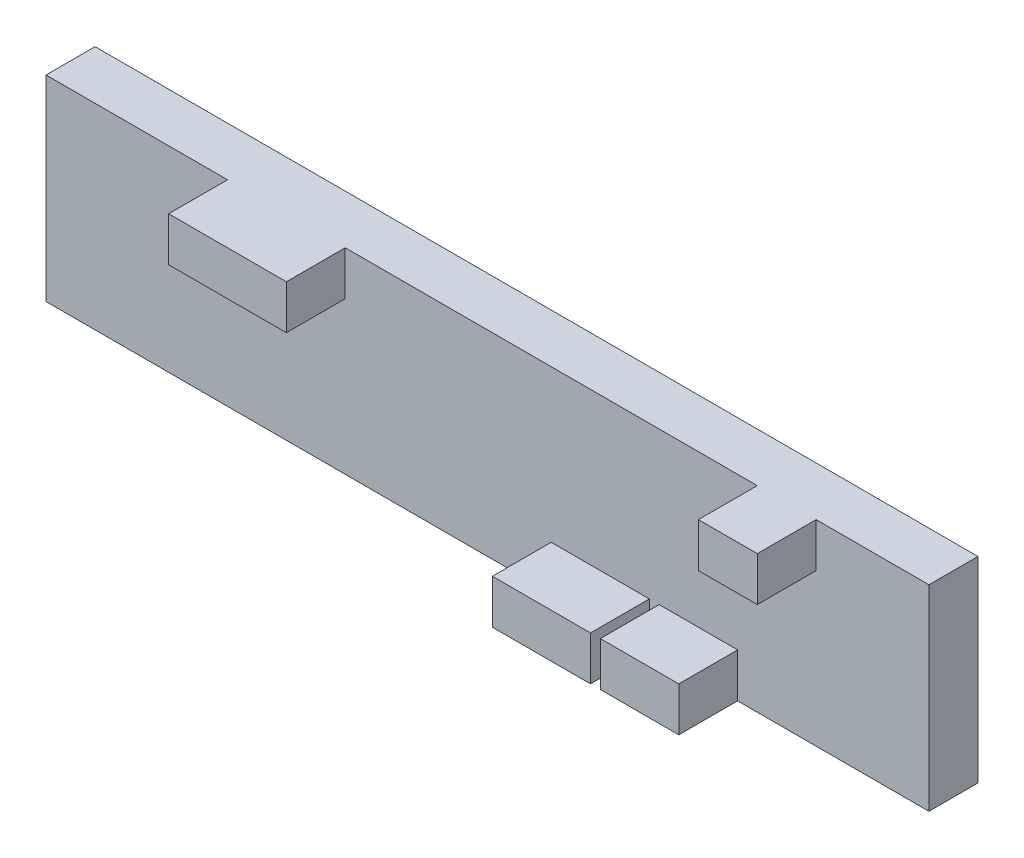
from build123d import *

# Parameters (mm, degrees)
SKETCH_1_W          = 91
SKETCH_1_H          = 20
EXTRUDE_1_DEPTH     = 5
SKETCH_2_W          = 12
SKETCH_2_H          = 4.5
SKETCH_2_W_2        = 6
SKETCH_2_W_3        = 10
SKETCH_2_W_4        = 8
EXTRUDE_2_DEPTH     = 6
SKETCH_3_W          = 5
SKETCH_3_H          = 20
CUT_EXTRUDE_1_DEPTH = 0.5
SKETCH_4_W          = 5
SKETCH_4_H          = 20
CUT_EXTRUDE_2_DEPTH = 0.5


with BuildPart() as part:
    # Эскиз1 → Бобышка-Вытянуть1 (new body)
    with BuildSketch(Plane.XY):
        with Locations((45.5, 10)):
            Rectangle(SKETCH_1_W, SKETCH_1_H)
    extrude(amount=EXTRUDE_1_DEPTH)

    # Эскиз2 → Бобышка-Вытянуть2 (add)
    with BuildSketch(Plane.XY.offset(5)):
        with Locations((25, 17.75)):
            Rectangle(SKETCH_2_W, SKETCH_2_H)
        with Locations((76, 17.75)):
            Rectangle(SKETCH_2_W_2, SKETCH_2_H)
        with Locations((57, 2.25)):
            Rectangle(SKETCH_2_W_3, SKETCH_2_H)
        with Locations((67, 2.25)):
            Rectangle(SKETCH_2_W_4, SKETCH_2_H)
    extrude(amount=EXTRUDE_2_DEPTH)

    # Эскиз3 → Вырез-Вытянуть1 (cut)
    with BuildSketch(Plane(origin=(91, 0, 0), x_dir=(0, 0, -1), z_dir=(1, 0, 0))):
        with Locations((-2.5, 10)):
            Rectangle(SKETCH_3_W, SKETCH_3_H)
    extrude(amount=-CUT_EXTRUDE_1_DEPTH, mode=Mode.SUBTRACT)

    # Эскиз4 → Вырез-Вытянуть2 (cut)
    with BuildSketch(Plane.ZY):
        with Locations((2.5, 10)):
            Rectangle(SKETCH_4_W, SKETCH_4_H)
    extrude(amount=-CUT_EXTRUDE_2_DEPTH, mode=Mode.SUBTRACT)


solid = part.part
